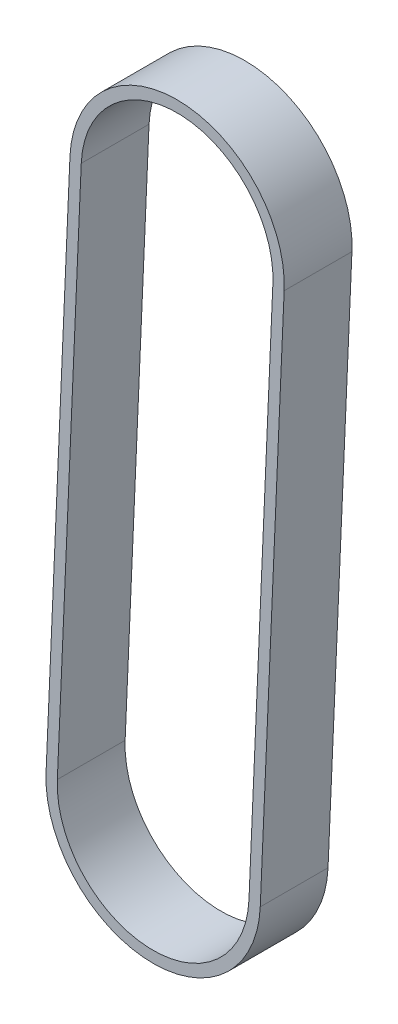
from build123d import *

# Parameters (mm, degrees)
EXTRUDE_THIN1_DEPTH = 9


with BuildPart() as part:
    # Sketch2 → Extrude-Thin1 (new body)
    with BuildSketch(Plane.XY):
        with BuildLine():
            Line((-17.393741198, -71.807162941), (-14.218741198, 0.623280778))
            ThreePointArc((-14.218741198, 0.623280778), (0.623280778, 14.218741198), (14.218741198, -0.623280778))
            Line((14.218741198, -0.623280778), (11.043741198, -73.053724497))
            ThreePointArc((11.043741198, -73.053724497), (-3.798280778, -86.649184917), (-17.393741198, -71.807162941))
        make_face()
        with BuildLine():
            Line((-15.895180265, -71.872852598), (-12.720180265, 0.557591121))
            ThreePointArc((-12.720180265, 0.557591121), (0.557591121, 12.720180265), (12.720180265, -0.557591121))
            Line((12.720180265, -0.557591121), (9.545180265, -72.988034841))
            ThreePointArc((9.545180265, -72.988034841), (-3.732591121, -85.150623984), (-15.895180265, -71.872852598))
        make_face(mode=Mode.SUBTRACT)
    extrude(amount=EXTRUDE_THIN1_DEPTH)


solid = part.part
